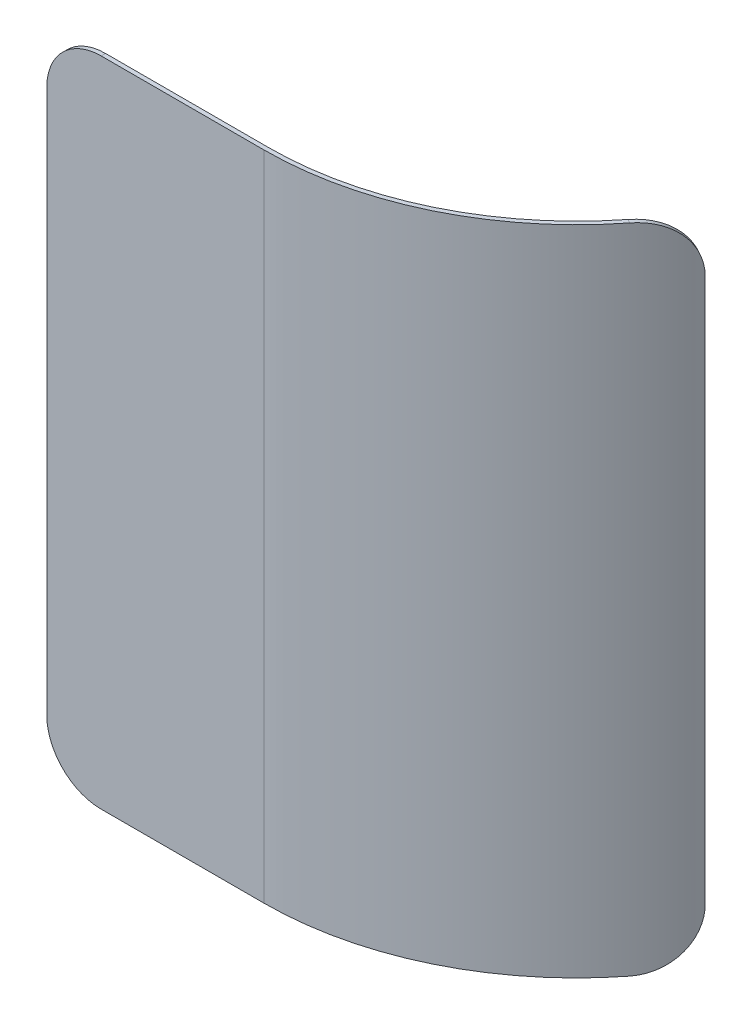
from build123d import *

# Parameters (mm, degrees)
EXTRUDE_THIN1_DEPTH = 152.4
FILLET1_START       = -34.928197123
FILLET1_DEPTH       = 36.928197123
FILLET1_START_2     = 1.736605499
FILLET1_2_DEPTH     = 83.263394501


with BuildPart() as part:
    # Sketch1 → Extrude-Thin1 (new body)
    with BuildSketch(Plane(origin=(0, 0, 0), x_dir=(1, 0, 0), z_dir=(0, 1, 0))):
        with BuildLine():
            Line((0, 0), (50.8, 0))
            ThreePointArc((50.8, 0), (87.824366436, 10.255859386), (114.294919797, 38.1))
            Line((114.294919797, 38.1), (115.191424136, 37.621945641))
            ThreePointArc((115.191424136, 37.621945641), (88.347124875, 9.384665025), (50.8, -1.016))
            Line((50.8, -1.016), (0, -1.016))
            Line((0, -1.016), (0, 0))
        make_face()
    extrude(amount=EXTRUDE_THIN1_DEPTH)

    # Fillet1: read off the stored shape, not the designer's step
    # Fillet1 outline → Fillet1 (cut)
    with BuildSketch(Plane.XY.offset(FILLET1_START)):
        with BuildLine():
            Line((0, 152.4), (0, 139.7))
            ThreePointArc((0, 139.7), (3.719743879, 148.680256121), (12.7, 152.4))
            Line((12.7, 152.4), (0, 152.4))
        make_face()
        with BuildLine():
            ThreePointArc((12.7, 0), (3.719743879, 3.719743879), (0, 12.7))
            Line((0, 12.7), (0, 0))
            Line((0, 0), (12.7, 0))
        make_face()
    extrude(amount=FILLET1_DEPTH, mode=Mode.SUBTRACT)

    # Fillet1 2 outline → Fillet1 2 (cut)
    with BuildSketch(Plane(origin=(0, 0, 0), x_dir=(0.4705259442287449, 0, -0.8823861602539153), z_dir=(0.8823861602539151, 0, 0.47052594422874505)).offset(FILLET1_START_2)):
        with BuildLine():
            Line((87.397637764, 0), (87.397637764, 12.7))
            ThreePointArc((87.397637764, 12.7), (83.677893885, 3.719743879), (74.697637764, 0))
            Line((74.697637764, 0), (87.397637764, 0))
        make_face()
        with BuildLine():
            ThreePointArc((74.697637764, 152.4), (83.677893885, 148.680256121), (87.397637764, 139.7))
            Line((87.397637764, 139.7), (87.397637764, 152.4))
            Line((87.397637764, 152.4), (74.697637764, 152.4))
        make_face()
    extrude(amount=FILLET1_2_DEPTH, mode=Mode.SUBTRACT)


solid = part.part
